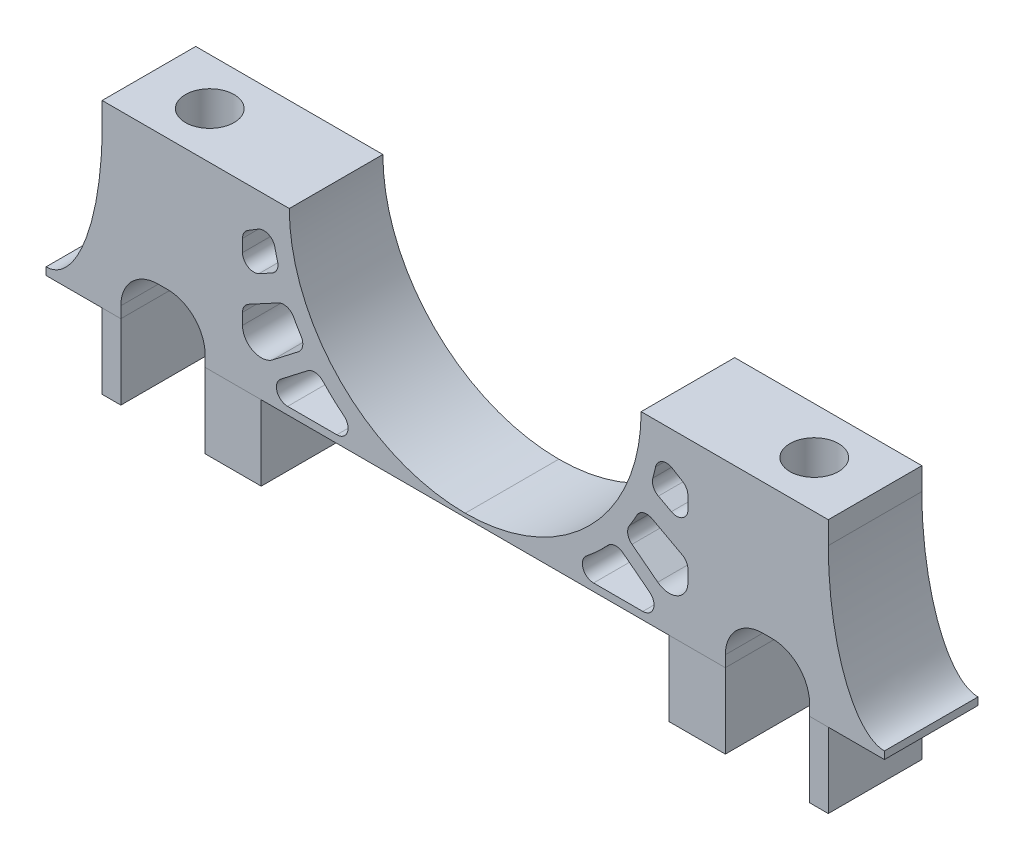
from build123d import *

# Parameters (mm, degrees)
BOSS_EXTRUDE1_DEPTH   = 6.35
FILLET2_R             = 2.54
FILLET5_SIZE          = 10.16
FILLET5_SIZE_2        = 3.81
FILLET3_R             = 0.762
FILLET4_R             = 1.27
M4X0_7_TAPPED_HOLE1_D = 3.3


with BuildPart() as part:
    # Sketch1 → Boss-Extrude1 (new body)
    with BuildSketch(Plane.XY):
        with BuildLine():
            Line((-49.276, 0.508), (-49.276, 12.192))
            Line((-49.276, 12.192), (-36.576, 12.192))
            ThreePointArc((-36.576, 12.192), (-24.638, 0.254), (-12.7, 12.192))
            Line((-12.7, 12.192), (0, 12.192))
            Line((0, 12.192), (0, 0.508))
            Line((0, 0.508), (3.81, 0.508))
            Line((3.81, 0.508), (3.81, 0))
            Line((3.81, 0), (0, 0))
            Line((0, 0), (0, -5.08))
            Line((0, -5.08), (-1.27, -5.08))
            Line((-1.27, -5.08), (-1.27, 3.302))
            Line((-1.27, 3.302), (-6.985, 3.302))
            Line((-6.985, 3.302), (-6.985, -5.08))
            Line((-6.985, -5.08), (-10.795, -5.08))
            Line((-10.795, -5.08), (-10.795, 0))
            Line((-10.795, 0), (-38.481, 0))
            Line((-38.481, 0), (-38.481, -5.08))
            Line((-38.481, -5.08), (-42.291, -5.08))
            Line((-42.291, -5.08), (-42.291, 3.302))
            Line((-42.291, 3.302), (-48.006, 3.302))
            Line((-48.006, 3.302), (-48.006, -5.08))
            Line((-48.006, -5.08), (-49.276, -5.08))
            Line((-49.276, -5.08), (-49.276, 0))
            Line((-49.276, 0), (-53.086, 0))
            Line((-53.086, 0), (-53.086, 0.508))
            Line((-53.086, 0.508), (-49.276, 0.508))
        make_face()
        with BuildLine():
            Line((-18.478827328, 0.508), (-10.355558408, 0.508))
            Line((-10.355558408, 0.508), (-14.507082252, 3.71758146))
            ThreePointArc((-14.507082252, 3.71758146), (-16.336366742, 1.919018483), (-18.478827328, 0.508))
        make_face(mode=Mode.SUBTRACT)
        with BuildLine():
            Line((-9.525, 1.150112382), (-13.88565937, 4.52137845))
            ThreePointArc((-13.88565937, 4.52137845), (-13.218881773, 5.554605714), (-12.651085576, 6.645366193))
            Line((-12.651085576, 6.645366193), (-9.525, 4.960112382))
            Line((-9.525, 4.960112382), (-9.525, 1.150112382))
        make_face(mode=Mode.SUBTRACT)
        with BuildLine():
            Line((-9.525, 6.738112382), (-12.07736066, 8.107688139))
            ThreePointArc((-12.07736066, 8.107688139), (-11.751952055, 9.293546556), (-11.53824026, 10.504528889))
            Line((-11.53824026, 10.504528889), (-9.525, 9.278112382))
            Line((-9.525, 9.278112382), (-9.525, 6.738112382))
        make_face(mode=Mode.SUBTRACT)
        with BuildLine():
            Line((-39.751, 9.278112382), (-39.751, 6.738112382))
            Line((-39.751, 6.738112382), (-37.19863934, 8.107688139))
            ThreePointArc((-37.19863934, 8.107688139), (-37.524047945, 9.293546556), (-37.73775974, 10.504528889))
            Line((-37.73775974, 10.504528889), (-39.751, 9.278112382))
        make_face(mode=Mode.SUBTRACT)
        with BuildLine():
            Line((-39.751, 4.960112382), (-39.751, 1.150112382))
            Line((-39.751, 1.150112382), (-35.39034063, 4.52137845))
            ThreePointArc((-35.39034063, 4.52137845), (-36.057118227, 5.554605714), (-36.624914424, 6.645366193))
            Line((-36.624914424, 6.645366193), (-39.751, 4.960112382))
        make_face(mode=Mode.SUBTRACT)
        with BuildLine():
            Line((-30.797172672, 0.508), (-38.920441592, 0.508))
            Line((-38.920441592, 0.508), (-34.768917748, 3.71758146))
            ThreePointArc((-34.768917748, 3.71758146), (-32.939633258, 1.919018483), (-30.797172672, 0.508))
        make_face(mode=Mode.SUBTRACT)
    extrude(amount=BOSS_EXTRUDE1_DEPTH)

    # Fillet2
    fillet2_edges = [part.edges().sort_by_distance(p)[0] for p in [
        (-1.27, 3.302, 3.175),
        (-6.985, 3.302, 3.175),
        (-42.291, 3.302, 3.175),
        (-48.006, 3.302, 3.175),
    ]]
    fillet(fillet2_edges, radius=FILLET2_R)

    # Fillet5
    # an asymmetric fillet: 10.16, 3.81 mm, written as the material it adds along each edge
    with BuildSketch(Plane(origin=(0, 0.508, 0), x_dir=(0, 1, 0), z_dir=(0, 0, 1))) as fillet5_piece_1:
        with BuildLine():
            Bezier((FILLET5_SIZE, 0), (0, 0), (0, -FILLET5_SIZE_2), weights=[1, 0.707106781, 1])
            Line((0, -FILLET5_SIZE_2), (0, 0))
            Line((0, 0), (FILLET5_SIZE, 0))
        make_face()
    extrude(amount=6.35)
    with BuildSketch(Plane(origin=(-49.276, 0.508, 0), x_dir=(-1, 0, 0), z_dir=(0, 0, 1))) as fillet5_piece_2:
        with BuildLine():
            Bezier((FILLET5_SIZE_2, 0), (0, 0), (0, -FILLET5_SIZE), weights=[1, 0.707106781, 1])
            Line((0, -FILLET5_SIZE), (0, 0))
            Line((0, 0), (FILLET5_SIZE_2, 0))
        make_face()
    extrude(amount=6.35)

    # Fillet3
    fillet3_edges = [part.edges().sort_by_distance(p)[0] for p in [
        (-9.525, 6.738112382, 3.175),
        (-9.525, 9.278112382, 3.175),
        (-11.53824026, 10.504528889, 3.175),
        (-12.07736066, 8.107688139, 3.175),
        (-36.624914424, 6.645366193, 3.175),
        (-39.751, 4.960112382, 3.175),
        (-35.39034063, 4.52137845, 3.175),
        (-30.797172672, 0.508, 3.175),
        (-34.768917748, 3.71758146, 3.175),
        (-38.920441592, 0.508, 3.175),
        (-14.507082252, 3.71758146, 3.175),
        (-18.478827328, 0.508, 3.175),
        (-10.355558408, 0.508, 3.175),
        (-37.73775974, 10.504528889, 3.175),
        (-39.751, 9.278112382, 3.175),
        (-39.751, 6.738112382, 3.175),
        (-37.19863934, 8.107688139, 3.175),
        (-9.525, 4.960112382, 3.175),
        (-12.651085576, 6.645366193, 3.175),
        (-13.88565937, 4.52137845, 3.175),
    ]]
    fillet(fillet3_edges, radius=FILLET3_R)

    # Fillet4
    fillet4_edges = [part.edges().sort_by_distance(p)[0] for p in [
        (-39.751, 1.150112382, 3.175),
        (-9.525, 1.150112382, 3.175),
    ]]
    fillet(fillet4_edges, radius=FILLET4_R)

    # M4x0.7 Tapped Hole1 (through all)
    with Locations(Plane(origin=(0, 12.192, 0), x_dir=(1, 0, 0), z_dir=(0, 1, 0))):
        with Locations((-4.1275, -3.175)):
            m4x0_7_tapped_hole1 = Hole(M4X0_7_TAPPED_HOLE1_D / 2)

    # Mirror1: M4x0.7 Tapped Hole1 across plane
    add(m4x0_7_tapped_hole1.mirror(Plane(origin=(-24.638, 0, 0), x_dir=(0, 0, 1), z_dir=(1, 0, 0))), mode=Mode.SUBTRACT)


solid = part.part
